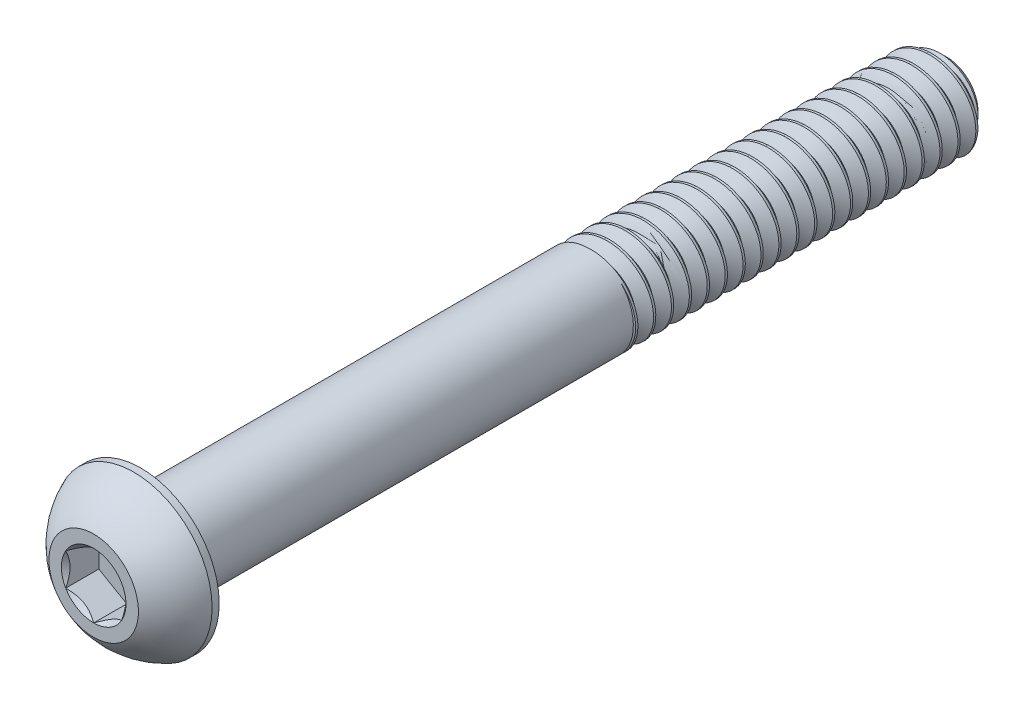
from build123d import *
from build123d.topology import SkipClean

# Parameters (mm, degrees)
SKETCH1_W           = 57.15
SKETCH1_H           = 3.175
CHAMFER1_SIZE       = 0.9525
CUT_SWEEP1_PITCH    = 1.27
CUT_EXTRUDE2_DEPTH  = 2.34696
BOSS_EXTRUDE2_START = -31.75
SKETCH9_R           = 3.175
BOSS_EXTRUDE2_DEPTH = 31.75


with BuildPart() as part:
    # Sketch1 → Revolve1 (revolve)
    with BuildSketch(Plane(origin=(0, 0, 0), x_dir=(0, 0, -1), z_dir=(1, 0, 0))):
        with Locations((31.9278, 1.5875)):
            Rectangle(SKETCH1_W, SKETCH1_H)
    revolve(axis=Axis((0, 0, -60.5028), (0, 0, 1)))

    # Chamfer1
    chamfer1_edges = [part.edges().sort_by_distance(p)[0] for p in [
        (0, -3.175, -60.5028),
    ]]
    chamfer(chamfer1_edges, length=CHAMFER1_SIZE)

    # Cut-Sweep1: arcs per turn and ends read off the stored shape
    # Cut-Sweep1: the profile of Sketch2 profile screwed along a right-hand helix through 46 turns, 8 arcs to a turn; built about Z, then put on its axis
    cut_sweep1_z = Axis((0, 0, 0), (0, 0, 1))
    cut_sweep1_corners = [(3.1756, 0, 0.00034641), (3.1756, 0, -1.11159641), (2.350110803, 0, -0.635), (2.350110803, 0, -0.47625)]
    with BuildLine(mode=Mode.PRIVATE) as cut_sweep1_profile:
        Line(cut_sweep1_corners[0], cut_sweep1_corners[1])
        Line(cut_sweep1_corners[1], cut_sweep1_corners[2])
        Line(cut_sweep1_corners[2], cut_sweep1_corners[3])
        Line(cut_sweep1_corners[3], cut_sweep1_corners[0])
    cut_sweep1_cap = Face(cut_sweep1_profile.wire())
    cut_sweep1_turn_angles = [0, 22.5, 45, 67.5, 90, 112.5, 135, 157.5, 180, 202.5, 225, 247.5, 270, 292.5, 315, 337.5, 360]
    cut_sweep1_turn_weights = [1, 0.9238795325112867, 1, 0.9238795325112867, 1, 0.9238795325112867, 1, 0.9238795325112867, 1, 0.9238795325112867, 1, 0.9238795325112867, 1, 0.9238795325112867, 1, 0.9238795325112867, 1]
    cut_sweep1_turn_rails = [Edge.make_bspline([Vector(p[0], p[1], 0).rotate(cut_sweep1_z, cut_sweep1_turn_angles[k]) / cut_sweep1_turn_weights[k] + Vector(0, 0, p[2] + CUT_SWEEP1_PITCH * cut_sweep1_turn_angles[k] / 360) for k in range(17)], [0, 0, 0, 1, 1, 2, 2, 3, 3, 4, 4, 5, 5, 6, 6, 7, 7, 8, 8, 8], 2, cut_sweep1_turn_weights) for p in cut_sweep1_corners]
    cut_sweep1_turn_sides = [Face.make_surface_from_curves(cut_sweep1_turn_rails[p[0]], cut_sweep1_turn_rails[p[1]]) for p in [(0, 1), (1, 2), (2, 3), (3, 0)]]
    cut_sweep1 = Plane(origin=(0, 0, -60.5028), x_dir=(0, 1, 0), z_dir=(0, 0, 1)) * Solid(Shell([*[p.moved(Location((0, 0, CUT_SWEEP1_PITCH * i))) for i in range(46) for p in cut_sweep1_turn_sides], cut_sweep1_cap, cut_sweep1_cap.rotate(cut_sweep1_z, 16560).moved(Location((0, 0, CUT_SWEEP1_PITCH * 16560 / 360)))]))
    add(cut_sweep1, mode=Mode.SUBTRACT)

    # Sketch7 → Revolve2 (revolve)
    with BuildSketch(Plane(origin=(0, 0, 0), x_dir=(0, 0, -1), z_dir=(1, 0, 0)), mode=Mode.PRIVATE) as revolve2_sk:
        with BuildLine():
            Line((2.84988, 5.5499), (3.3528, 5.5499))
            Line((3.3528, 5.5499), (3.3528, 0))
            Line((3.3528, 0), (0, 0))
            Line((0, 0), (0, 3.175))
            ThreePointArc((0, 3.175), (1.235921075, 4.58927271), (2.84988, 5.5499))
        make_face()
    revolve(revolve2_sk.sketch.rotate(Axis((0, 0, 0), (0, 0, -1)), 189.052465709), axis=Axis((0, 0, 0), (0, 0, -1)))

    # Sketch5 → Cut-Extrude2 (cut)
    with BuildSketch(Plane.XY):
        Polygon((1.984375, -1.14567944), (1.984375, 1.14567944), (0, 2.291358881), (-1.984375, 1.14567944), (-1.984375, -1.14567944), (0, -2.291358881), align=None)
    extrude(amount=-CUT_EXTRUDE2_DEPTH, mode=Mode.SUBTRACT)

    # Cut-Extrude3 cone 1 section (through the dimple's axis) → Cut-Extrude3 (revolve, cut)
    with BuildSketch(Plane(origin=(0, 0, 0), x_dir=(0, -1, 0), z_dir=(1, 0, 0))):
        Polygon((0, 0), (2.291358881, 0), (0, 2.291358881), align=None)
    revolve(axis=Axis((0, 0, 0), (0, 0, -1)), mode=Mode.SUBTRACT)

    # Sketch9 → Boss-Extrude2 (add)
    with SkipClean():  # the faces are left unmerged after this step: merging them gives an invalid solid
        with BuildSketch(Plane.XY.offset(-3.3528).offset(BOSS_EXTRUDE2_START)):
            with Locations(Location((0, 0, 0), (0, 0, 90))):
                Circle(SKETCH9_R)
        extrude(amount=BOSS_EXTRUDE2_DEPTH)


solid = part.part
